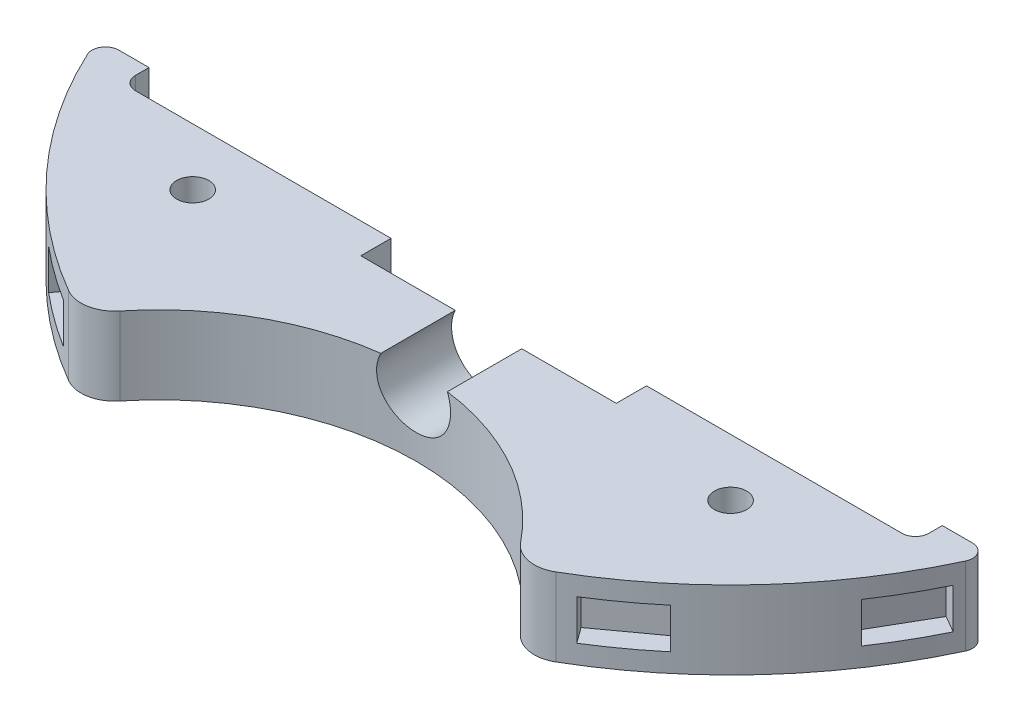
from build123d import *

# Parameters (mm, degrees)
BOSS_EXTRUDE1_DEPTH  = 5.8
SOLENOID_PLACEMENT_W = 38
SOLENOID_PLACEMENT_H = 64
CUT_EXTRUDE1_DEPTH   = 103.481998419
SKETCH6_R            = 2.4
CUT_EXTRUDE6_DEPTH   = 103.481998419
CUT_EXTRUDE3_DEPTH   = 103.481998419
FILLET1_R            = 2
CUT_EXTRUDE7_DEPTH   = 3
SKETCH11_R           = 5.5
CUT_EXTRUDE8_DEPTH   = 72.028583754


with BuildPart() as part:
    # Sketch1 → Boss-Extrude1 (new, symmetric)
    with BuildSketch(Plane(origin=(0, 0, 0), x_dir=(1, 0, 0), z_dir=(0, 1, 0))):
        with BuildLine():
            ThreePointArc((36.224522061, -62.223661106), (0, 72), (-36.224522061, -62.223661106))
            ThreePointArc((-36.224522061, -62.223661106), (-32.797800029, -62.818856853), (-29.811944095, -61.035223988))
            ThreePointArc((-29.811944095, -61.035223988), (0, -46.75), (29.811944095, -61.035223988))
            ThreePointArc((29.811944095, -61.035223988), (32.797800029, -62.818856853), (36.224522061, -62.223661106))
        make_face()
    extrude(amount=BOSS_EXTRUDE1_DEPTH, both=True)

    # solenoid placement → Cut-Extrude1 (cut, through all)
    with BuildSketch(Plane(origin=(0, 5.8, 0), x_dir=(1, 0, 0), z_dir=(0, 1, 0))):
        with Locations((0, -4)):
            Rectangle(SOLENOID_PLACEMENT_W, SOLENOID_PLACEMENT_H)
    extrude(amount=-CUT_EXTRUDE1_DEPTH, mode=Mode.SUBTRACT)

    # Sketch6 → Cut-Extrude6 (cut, through all)
    with BuildSketch(Plane(origin=(0, 5.8, 0), x_dir=(1, 0, 0), z_dir=(0, 1, 0))):
        with Locations((40, -40)):
            Circle(SKETCH6_R)
        with Locations((-40, -40)):
            Circle(SKETCH6_R)
    extrude(amount=-CUT_EXTRUDE6_DEPTH, mode=Mode.SUBTRACT)

    # Sketch3 → Cut-Extrude3 (cut, through all)
    with BuildSketch(Plane(origin=(0, 5.8, 0), x_dir=(1, 0, 0), z_dir=(0, 1, 0))):
        Polygon((-72, -27.5), (-59, -27.5), (-59, -31.5), (59, -31.5), (59, -27.5), (72, -27.5), (72, 31.5), (72, 72), (-72, 72), (-72, 31.5), align=None)
    extrude(amount=-CUT_EXTRUDE3_DEPTH, mode=Mode.SUBTRACT)

    # Fillet1
    fillet1_edges = [part.edges().sort_by_distance(p)[0] for p in [
        (66.541340534, 0, 27.5),
        (59, 0, 31.5),
        (-66.541340534, 0, 27.5),
        (-59, 0, 31.5),
    ]]
    fillet(fillet1_edges, radius=FILLET1_R)

    # Sketch9 → Cut-Extrude7 (cut, symmetric)
    with BuildSketch(Plane(origin=(0, 0, 0), x_dir=(1, 0, 0), z_dir=(0, 1, 0))):
        with BuildLine():
            Line((-64.703295733, -31.582962517), (-62.191822062, -30.132962517))
            Line((-62.191822062, -30.132962517), (-57.191822062, -38.793216555))
            Line((-57.191822062, -38.793216555), (-59.703295733, -40.243216555))
            ThreePointArc((-59.703295733, -40.243216555), (-62.353829072, -36), (-64.703295733, -31.582962517))
        make_face()
        with BuildLine():
            Line((-46.263453759, -55.169673248), (-44.558876527, -52.823523965))
            Line((-44.558876527, -52.823523965), (-36.468706583, -58.701376488))
            Line((-36.468706583, -58.701376488), (-38.173283815, -61.047525771))
            ThreePointArc((-38.173283815, -61.047525771), (-42.320538165, -58.249223595), (-46.263453759, -55.169673248))
        make_face()
        with BuildLine():
            Line((38.173283815, -61.047525771), (36.468706583, -58.701376488))
            Line((36.468706583, -58.701376488), (44.558876527, -52.823523965))
            Line((44.558876527, -52.823523965), (46.263453759, -55.169673248))
            ThreePointArc((46.263453759, -55.169673248), (42.320538165, -58.249223595), (38.173283815, -61.047525771))
        make_face()
        with BuildLine():
            Line((59.703295733, -40.243216555), (57.191822062, -38.793216555))
            Line((57.191822062, -38.793216555), (62.191822062, -30.132962517))
            Line((62.191822062, -30.132962517), (64.703295733, -31.582962517))
            ThreePointArc((64.703295733, -31.582962517), (62.353829072, -36), (59.703295733, -40.243216555))
        make_face()
    extrude(amount=CUT_EXTRUDE7_DEPTH, both=True, mode=Mode.SUBTRACT)

    # Sketch11 → Cut-Extrude8 (cut, through all)
    with BuildSketch(Plane(origin=(0, 0, 36), x_dir=(-1, 0, 0), z_dir=(0, 0, -1))):
        with Locations((0, 3.4)):
            Circle(SKETCH11_R)
    extrude(amount=-CUT_EXTRUDE8_DEPTH, mode=Mode.SUBTRACT)


solid = part.part
